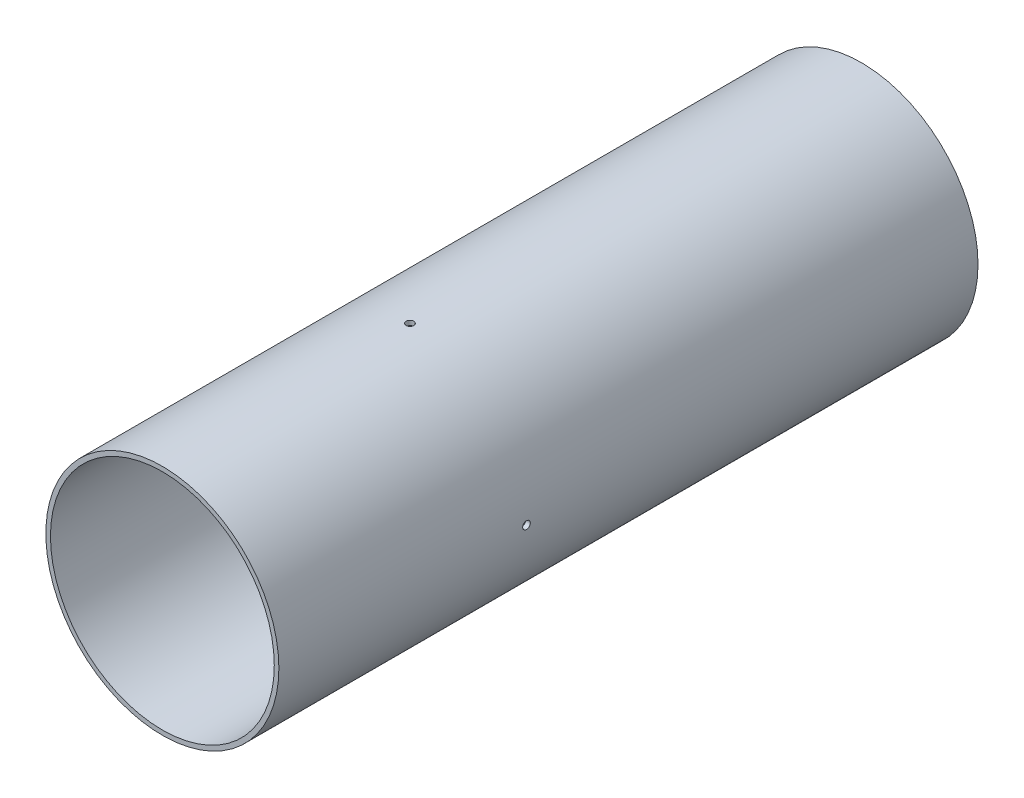
from build123d import *

# Parameters (mm, degrees)
SKETCH1_R           = 50.8
SKETCH1_R_2         = 48.7934
BOSS_EXTRUDE1_DEPTH = 304.8
CUT_EXTRUDE1_REACH  = 327.279
SKETCH2_R           = 1.651
CIRPATTERN1_COUNT   = 4


with BuildPart() as part:
    # Sketch1 → Boss-Extrude1 (new body)
    with BuildSketch(Plane.XY):
        Circle(SKETCH1_R)
        Circle(SKETCH1_R_2, mode=Mode.SUBTRACT)
    extrude(amount=BOSS_EXTRUDE1_DEPTH)

    # Sketch2 → Cut-Extrude1 (cut, up to next)
    with BuildSketch(Plane.ZY.offset(50.8), mode=Mode.PRIVATE) as cut_extrude1_sk1:
        with Locations((196.85, 0)):
            Circle(SKETCH2_R)
    cut_extrude1_tool1 = extrude(cut_extrude1_sk1.sketch, amount=-CUT_EXTRUDE1_REACH, mode=Mode.PRIVATE) & part.part
    cut_extrude1 = cut_extrude1_tool1.solids().sort_by_distance((-50.8, 0, 196.85))[0]
    add(cut_extrude1, mode=Mode.SUBTRACT)

    # CirPattern1: Cut-Extrude1 ×4 about axis
    cirpattern1_axis = Axis((0, 0, 304.8), (0, 0, -1))
    for i in range(1, CIRPATTERN1_COUNT):
        add(cut_extrude1.rotate(cirpattern1_axis, i * 360 / CIRPATTERN1_COUNT), mode=Mode.SUBTRACT)


solid = part.part
